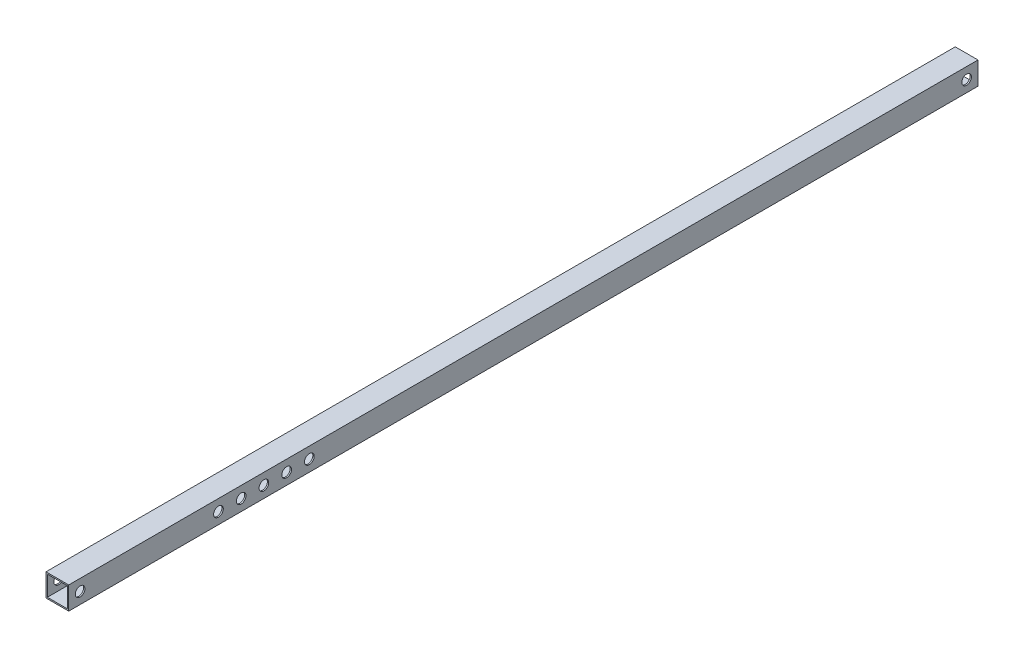
from build123d import *

# Parameters (mm, degrees)
SKETCH1_W           = 20
SKETCH1_H           = 20
SKETCH1_W_2         = 17.6
SKETCH1_H_2         = 17.6
BOSS_EXTRUDE1_DEPTH = 800
SKETCH2_R           = 4.25
CUT_EXTRUDE1_DEPTH  = 801.312438989
SKETCH3_R           = 4.25
CUT_EXTRUDE2_DEPTH  = 801.312438989


with BuildPart() as part:
    # Sketch1 → Boss-Extrude1 (new body)
    with BuildSketch(Plane.XY):
        Rectangle(SKETCH1_W, SKETCH1_H)
        Rectangle(SKETCH1_W_2, SKETCH1_H_2, mode=Mode.SUBTRACT)
    extrude(amount=BOSS_EXTRUDE1_DEPTH)

    # Sketch2 → Cut-Extrude1 (cut, through all)
    with BuildSketch(Plane(origin=(10, 0, 0), x_dir=(0, 0, -1), z_dir=(1, 0, 0))):
        with Locations((-10, 0)):
            Circle(SKETCH2_R)
        with Locations((-790, 0)):
            Circle(SKETCH2_R)
    extrude(amount=-CUT_EXTRUDE1_DEPTH, mode=Mode.SUBTRACT)

    # Sketch3 → Cut-Extrude2 (cut, through all)
    with BuildSketch(Plane.ZY.offset(10)):
        with Locations((628.265703399, 0)):
            Circle(SKETCH3_R)
        with Locations((648.265703399, 0)):
            Circle(SKETCH3_R)
        with Locations((668.265703399, 0)):
            Circle(SKETCH3_R)
        with Locations((608.265703399, 0)):
            Circle(SKETCH3_R)
        with Locations((588.265703399, 0)):
            Circle(SKETCH3_R)
    extrude(amount=-CUT_EXTRUDE2_DEPTH, mode=Mode.SUBTRACT)


solid = part.part
